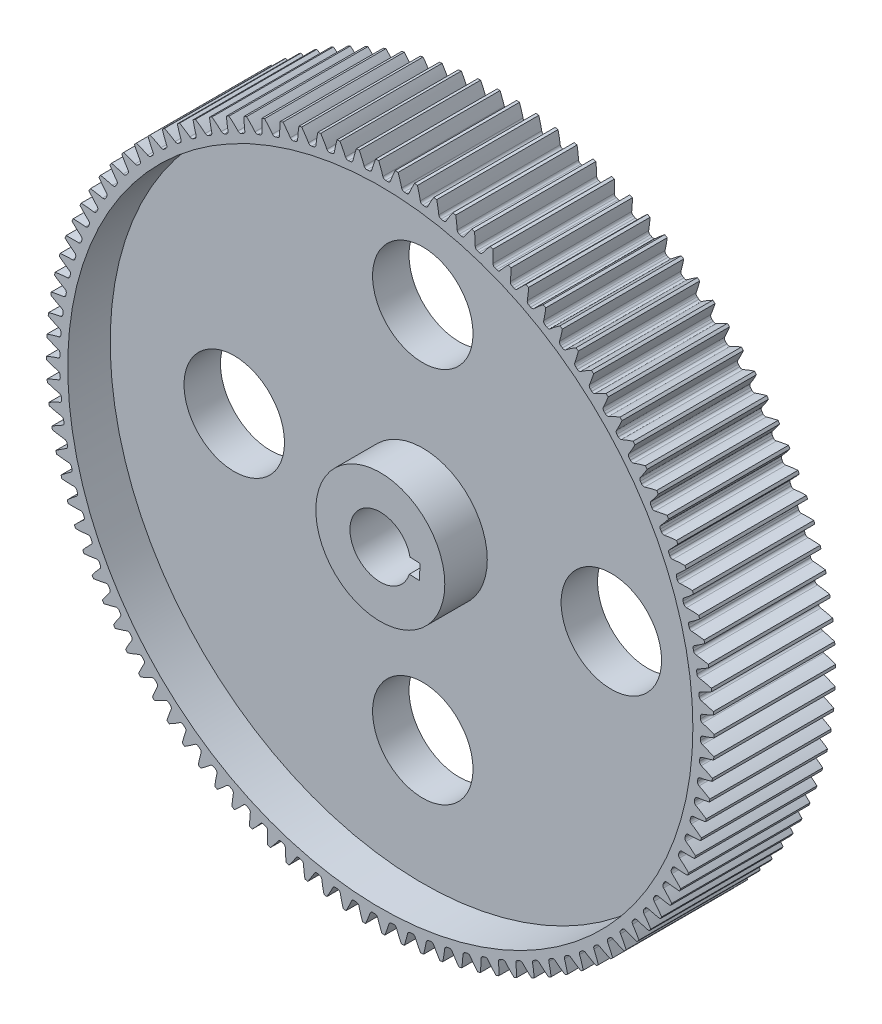
from build123d import *

# Parameters (mm, degrees)
SKETCH3_R          = 110
GEARBODY_DEPTH     = 40
TOOTHCUT_DEPTH     = 161.623784042
CIRPATTERN1_COUNT  = 108
BOREDIA_R          = 10
BORE_DEPTH         = 12700
KWY1_DEPTH         = 6350
SKETCH4_R          = 103
SKETCH4_R_2        = 21.25
CUT_EXTRUDE1_DEPTH = 14
CUT_EXTRUDE2_START = -14
SKETCH5_R          = 103
SKETCH5_R_2        = 21.25
CUT_EXTRUDE2_DEPTH = 14
SKETCH6_R          = 16.55
CUT_EXTRUDE3_DEPTH = 14


with BuildPart() as part:
    # Sketch3 → gearBody (new body)
    with BuildSketch(Plane.XY):
        Circle(SKETCH3_R)
    extrude(amount=GEARBODY_DEPTH)

    # Sketch2 → toothCut (cut, through all)
    with BuildSketch(Plane.XY):
        with BuildLine():
            ThreePointArc((105.52103226, -2.438313216), (105.528502771, -2.090149172), (105.534824526, -1.741962375))
            ThreePointArc((105.534824526, -1.741962375), (105.723201591, -1.190490534), (106.19873971, -0.853636549))
            ThreePointArc((106.19873971, -0.853636549), (118.532363291, 5.423801056), (128.123754846, 15.400258422))
            ThreePointArc((128.123754846, 15.400258422), (129.020673568, -2.555446604), (127.413458248, -20.461553525))
            ThreePointArc((127.413458248, -20.461553525), (118.224631311, -10.11312596), (106.149251312, -3.352231685))
            ThreePointArc((106.149251312, -3.352231685), (105.687424709, -2.996811795), (105.52103226, -2.438313216))
        make_face()
    toothcut = extrude(amount=TOOTHCUT_DEPTH, mode=Mode.SUBTRACT)

    # CirPattern1: toothCut ×108 about axis
    cirpattern1_axis = Axis((0, 0, 40), (0, 0, -1))
    for i in range(1, CIRPATTERN1_COUNT):
        add(toothcut.rotate(cirpattern1_axis, i * 360 / CIRPATTERN1_COUNT), mode=Mode.SUBTRACT)

    # boreDia → bore (cut, symmetric)
    with BuildSketch(Plane.XY):
        Circle(BOREDIA_R)
    extrude(amount=BORE_DEPTH, both=True, mode=Mode.SUBTRACT)

    # kwy1sketch → kwy1 (cut, symmetric)
    with BuildSketch(Plane.XY):
        Polygon((13.106647966, 1.861660307), (12.862281748, -3.132364639), (6.619750567, -2.826906866), (0, 0), (6.864116785, 2.167118079), align=None)
    extrude(amount=KWY1_DEPTH, both=True, mode=Mode.SUBTRACT)

    # Sketch4 → Cut-Extrude1 (cut)
    with BuildSketch(Plane(origin=(0, 0, 0), x_dir=(-1, 0, 0), z_dir=(0, 0, -1))):
        Circle(SKETCH4_R)
        Circle(SKETCH4_R_2, mode=Mode.SUBTRACT)
    extrude(amount=-CUT_EXTRUDE1_DEPTH, mode=Mode.SUBTRACT)

    # Sketch5 → Cut-Extrude2 (cut)
    with BuildSketch(Plane.XY.offset(40).offset(CUT_EXTRUDE2_START)):
        Circle(SKETCH5_R)
        Circle(SKETCH5_R_2, mode=Mode.SUBTRACT)
    extrude(amount=CUT_EXTRUDE2_DEPTH, mode=Mode.SUBTRACT)

    # Sketch6 → Cut-Extrude3 (cut)
    with BuildSketch(Plane.XY.offset(26)):
        with Locations((0, -62.125)):
            Circle(SKETCH6_R)
        with Locations((62.125, 0)):
            Circle(SKETCH6_R)
        with Locations((0, 62.125)):
            Circle(SKETCH6_R)
        with Locations((-62.125, 0)):
            Circle(SKETCH6_R)
    extrude(amount=-CUT_EXTRUDE3_DEPTH, mode=Mode.SUBTRACT)


solid = part.part
